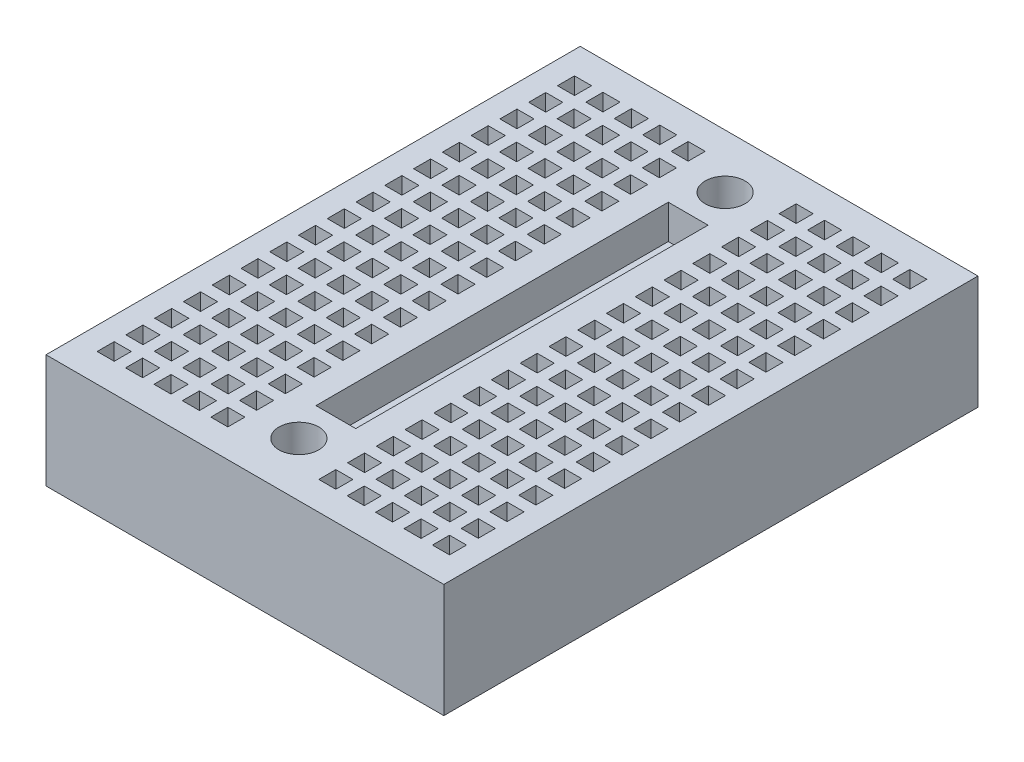
from build123d import *
from build123d.topology import SkipClean

# Parameters (mm, degrees)
SKETCH2_W           = 17.5
SKETCH2_H           = 47
BOSS_EXTRUDE1_DEPTH = 7
SKETCH3_W           = 1.5
SKETCH3_H           = 1.5
BOSS_EXTRUDE2_DEPTH = 3


with BuildPart() as part:
    # Sketch2 → Boss-Extrude1 (new body)
    with BuildSketch(Plane(origin=(0, 0, 0), x_dir=(1, 0, 0), z_dir=(0, 1, 0))):
        with Locations((-8.75, 0)):
            Rectangle(SKETCH2_W, SKETCH2_H)
    boss_extrude1 = extrude(amount=BOSS_EXTRUDE1_DEPTH)

    # Sketch3 → Boss-Extrude2 (add)
    with BuildSketch(Plane(origin=(0, 7, 0), x_dir=(1, 0, 0), z_dir=(0, 1, 0))):
        with BuildLine():
            Line((0, -17), (0, -15.5))
            Line((0, -15.5), (-1.75, -15.5))
            Line((-1.75, -15.5), (-1.75, 15.5))
            Line((-1.75, 15.5), (0, 15.5))
            Line((0, 15.5), (0, 17))
            ThreePointArc((0, 17), (-1.75, 18.75), (0, 20.5))
            Line((0, 20.5), (0, 23.5))
            Line((0, 23.5), (-17.5, 23.5))
            Line((-17.5, 23.5), (-17.5, -23.5))
            Line((-17.5, -23.5), (0, -23.5))
            Line((0, -23.5), (0, -20.5))
            ThreePointArc((0, -20.5), (-1.75, -18.75), (0, -17))
        make_face()
        with Locations((-14.75, -20.25)):
            Rectangle(SKETCH3_W, SKETCH3_H, mode=Mode.SUBTRACT)
        with Locations((-14.75, -17.71875)):
            Rectangle(SKETCH3_W, SKETCH3_H, mode=Mode.SUBTRACT)
        with Locations((-14.75, -15.1875)):
            Rectangle(SKETCH3_W, SKETCH3_H, mode=Mode.SUBTRACT)
        with Locations((-14.75, -12.65625)):
            Rectangle(SKETCH3_W, SKETCH3_H, mode=Mode.SUBTRACT)
        with Locations((-12.25, -20.25)):
            Rectangle(SKETCH3_W, SKETCH3_H, mode=Mode.SUBTRACT)
        with Locations((-12.25, -17.71875)):
            Rectangle(SKETCH3_W, SKETCH3_H, mode=Mode.SUBTRACT)
        with Locations((-9.75, -20.25)):
            Rectangle(SKETCH3_W, SKETCH3_H, mode=Mode.SUBTRACT)
        with Locations((-9.75, -17.71875)):
            Rectangle(SKETCH3_W, SKETCH3_H, mode=Mode.SUBTRACT)
        with Locations((-12.25, -15.1875)):
            Rectangle(SKETCH3_W, SKETCH3_H, mode=Mode.SUBTRACT)
        with Locations((-12.25, -12.65625)):
            Rectangle(SKETCH3_W, SKETCH3_H, mode=Mode.SUBTRACT)
        with Locations((-9.75, -15.1875)):
            Rectangle(SKETCH3_W, SKETCH3_H, mode=Mode.SUBTRACT)
        with Locations((-9.75, -12.65625)):
            Rectangle(SKETCH3_W, SKETCH3_H, mode=Mode.SUBTRACT)
        with Locations((-14.75, -10.125)):
            Rectangle(SKETCH3_W, SKETCH3_H, mode=Mode.SUBTRACT)
        with Locations((-14.75, -7.59375)):
            Rectangle(SKETCH3_W, SKETCH3_H, mode=Mode.SUBTRACT)
        with Locations((-14.75, -5.0625)):
            Rectangle(SKETCH3_W, SKETCH3_H, mode=Mode.SUBTRACT)
        with Locations((-14.75, -2.53125)):
            Rectangle(SKETCH3_W, SKETCH3_H, mode=Mode.SUBTRACT)
        with Locations((-12.25, -10.125)):
            Rectangle(SKETCH3_W, SKETCH3_H, mode=Mode.SUBTRACT)
        with Locations((-12.25, -7.59375)):
            Rectangle(SKETCH3_W, SKETCH3_H, mode=Mode.SUBTRACT)
        with Locations((-9.75, -10.125)):
            Rectangle(SKETCH3_W, SKETCH3_H, mode=Mode.SUBTRACT)
        with Locations((-9.75, -7.59375)):
            Rectangle(SKETCH3_W, SKETCH3_H, mode=Mode.SUBTRACT)
        with Locations((-12.25, -5.0625)):
            Rectangle(SKETCH3_W, SKETCH3_H, mode=Mode.SUBTRACT)
        with Locations((-12.25, -2.53125)):
            Rectangle(SKETCH3_W, SKETCH3_H, mode=Mode.SUBTRACT)
        with Locations((-9.75, -5.0625)):
            Rectangle(SKETCH3_W, SKETCH3_H, mode=Mode.SUBTRACT)
        with Locations((-9.75, -2.53125)):
            Rectangle(SKETCH3_W, SKETCH3_H, mode=Mode.SUBTRACT)
        with Locations((-7.25, -20.25)):
            Rectangle(SKETCH3_W, SKETCH3_H, mode=Mode.SUBTRACT)
        with Locations((-7.25, -17.71875)):
            Rectangle(SKETCH3_W, SKETCH3_H, mode=Mode.SUBTRACT)
        with Locations((-4.75, -20.25)):
            Rectangle(SKETCH3_W, SKETCH3_H, mode=Mode.SUBTRACT)
        with Locations((-4.75, -17.71875)):
            Rectangle(SKETCH3_W, SKETCH3_H, mode=Mode.SUBTRACT)
        with Locations((-7.25, -15.1875)):
            Rectangle(SKETCH3_W, SKETCH3_H, mode=Mode.SUBTRACT)
        with Locations((-7.25, -12.65625)):
            Rectangle(SKETCH3_W, SKETCH3_H, mode=Mode.SUBTRACT)
        with Locations((-4.75, -15.1875)):
            Rectangle(SKETCH3_W, SKETCH3_H, mode=Mode.SUBTRACT)
        with Locations((-4.75, -12.65625)):
            Rectangle(SKETCH3_W, SKETCH3_H, mode=Mode.SUBTRACT)
        with Locations((-7.25, -10.125)):
            Rectangle(SKETCH3_W, SKETCH3_H, mode=Mode.SUBTRACT)
        with Locations((-7.25, -7.59375)):
            Rectangle(SKETCH3_W, SKETCH3_H, mode=Mode.SUBTRACT)
        with Locations((-4.75, -10.125)):
            Rectangle(SKETCH3_W, SKETCH3_H, mode=Mode.SUBTRACT)
        with Locations((-4.75, -7.59375)):
            Rectangle(SKETCH3_W, SKETCH3_H, mode=Mode.SUBTRACT)
        with Locations((-7.25, -5.0625)):
            Rectangle(SKETCH3_W, SKETCH3_H, mode=Mode.SUBTRACT)
        with Locations((-7.25, -2.53125)):
            Rectangle(SKETCH3_W, SKETCH3_H, mode=Mode.SUBTRACT)
        with Locations((-4.75, -5.0625)):
            Rectangle(SKETCH3_W, SKETCH3_H, mode=Mode.SUBTRACT)
        with Locations((-4.75, -2.53125)):
            Rectangle(SKETCH3_W, SKETCH3_H, mode=Mode.SUBTRACT)
        with Locations((-14.75, 0)):
            Rectangle(SKETCH3_W, SKETCH3_H, mode=Mode.SUBTRACT)
        with Locations((-14.75, 2.53125)):
            Rectangle(SKETCH3_W, SKETCH3_H, mode=Mode.SUBTRACT)
        with Locations((-14.75, 5.0625)):
            Rectangle(SKETCH3_W, SKETCH3_H, mode=Mode.SUBTRACT)
        with Locations((-14.75, 7.59375)):
            Rectangle(SKETCH3_W, SKETCH3_H, mode=Mode.SUBTRACT)
        with Locations((-14.75, 10.125)):
            Rectangle(SKETCH3_W, SKETCH3_H, mode=Mode.SUBTRACT)
        with Locations((-12.25, 0)):
            Rectangle(SKETCH3_W, SKETCH3_H, mode=Mode.SUBTRACT)
        with Locations((-12.25, 2.53125)):
            Rectangle(SKETCH3_W, SKETCH3_H, mode=Mode.SUBTRACT)
        with Locations((-12.25, 5.0625)):
            Rectangle(SKETCH3_W, SKETCH3_H, mode=Mode.SUBTRACT)
        with Locations((-9.75, 0)):
            Rectangle(SKETCH3_W, SKETCH3_H, mode=Mode.SUBTRACT)
        with Locations((-9.75, 2.53125)):
            Rectangle(SKETCH3_W, SKETCH3_H, mode=Mode.SUBTRACT)
        with Locations((-9.75, 5.0625)):
            Rectangle(SKETCH3_W, SKETCH3_H, mode=Mode.SUBTRACT)
        with Locations((-12.25, 7.59375)):
            Rectangle(SKETCH3_W, SKETCH3_H, mode=Mode.SUBTRACT)
        with Locations((-12.25, 10.125)):
            Rectangle(SKETCH3_W, SKETCH3_H, mode=Mode.SUBTRACT)
        with Locations((-9.75, 7.59375)):
            Rectangle(SKETCH3_W, SKETCH3_H, mode=Mode.SUBTRACT)
        with Locations((-9.75, 10.125)):
            Rectangle(SKETCH3_W, SKETCH3_H, mode=Mode.SUBTRACT)
        with Locations((-14.75, 12.65625)):
            Rectangle(SKETCH3_W, SKETCH3_H, mode=Mode.SUBTRACT)
        with Locations((-14.75, 15.1875)):
            Rectangle(SKETCH3_W, SKETCH3_H, mode=Mode.SUBTRACT)
        with Locations((-14.75, 17.71875)):
            Rectangle(SKETCH3_W, SKETCH3_H, mode=Mode.SUBTRACT)
        with Locations((-14.75, 20.25)):
            Rectangle(SKETCH3_W, SKETCH3_H, mode=Mode.SUBTRACT)
        with Locations((-12.25, 12.65625)):
            Rectangle(SKETCH3_W, SKETCH3_H, mode=Mode.SUBTRACT)
        with Locations((-12.25, 15.1875)):
            Rectangle(SKETCH3_W, SKETCH3_H, mode=Mode.SUBTRACT)
        with Locations((-9.75, 12.65625)):
            Rectangle(SKETCH3_W, SKETCH3_H, mode=Mode.SUBTRACT)
        with Locations((-9.75, 15.1875)):
            Rectangle(SKETCH3_W, SKETCH3_H, mode=Mode.SUBTRACT)
        with Locations((-12.25, 17.71875)):
            Rectangle(SKETCH3_W, SKETCH3_H, mode=Mode.SUBTRACT)
        with Locations((-12.25, 20.25)):
            Rectangle(SKETCH3_W, SKETCH3_H, mode=Mode.SUBTRACT)
        with Locations((-9.75, 17.71875)):
            Rectangle(SKETCH3_W, SKETCH3_H, mode=Mode.SUBTRACT)
        with Locations((-9.75, 20.25)):
            Rectangle(SKETCH3_W, SKETCH3_H, mode=Mode.SUBTRACT)
        with Locations((-7.25, 0)):
            Rectangle(SKETCH3_W, SKETCH3_H, mode=Mode.SUBTRACT)
        with Locations((-7.25, 2.53125)):
            Rectangle(SKETCH3_W, SKETCH3_H, mode=Mode.SUBTRACT)
        with Locations((-7.25, 5.0625)):
            Rectangle(SKETCH3_W, SKETCH3_H, mode=Mode.SUBTRACT)
        with Locations((-4.75, 0)):
            Rectangle(SKETCH3_W, SKETCH3_H, mode=Mode.SUBTRACT)
        with Locations((-4.75, 2.53125)):
            Rectangle(SKETCH3_W, SKETCH3_H, mode=Mode.SUBTRACT)
        with Locations((-4.75, 5.0625)):
            Rectangle(SKETCH3_W, SKETCH3_H, mode=Mode.SUBTRACT)
        with Locations((-7.25, 7.59375)):
            Rectangle(SKETCH3_W, SKETCH3_H, mode=Mode.SUBTRACT)
        with Locations((-7.25, 10.125)):
            Rectangle(SKETCH3_W, SKETCH3_H, mode=Mode.SUBTRACT)
        with Locations((-4.75, 7.59375)):
            Rectangle(SKETCH3_W, SKETCH3_H, mode=Mode.SUBTRACT)
        with Locations((-4.75, 10.125)):
            Rectangle(SKETCH3_W, SKETCH3_H, mode=Mode.SUBTRACT)
        with Locations((-7.25, 12.65625)):
            Rectangle(SKETCH3_W, SKETCH3_H, mode=Mode.SUBTRACT)
        with Locations((-7.25, 15.1875)):
            Rectangle(SKETCH3_W, SKETCH3_H, mode=Mode.SUBTRACT)
        with Locations((-4.75, 12.65625)):
            Rectangle(SKETCH3_W, SKETCH3_H, mode=Mode.SUBTRACT)
        with Locations((-4.75, 15.1875)):
            Rectangle(SKETCH3_W, SKETCH3_H, mode=Mode.SUBTRACT)
        with Locations((-7.25, 17.71875)):
            Rectangle(SKETCH3_W, SKETCH3_H, mode=Mode.SUBTRACT)
        with Locations((-7.25, 20.25)):
            Rectangle(SKETCH3_W, SKETCH3_H, mode=Mode.SUBTRACT)
        with Locations((-4.75, 17.71875)):
            Rectangle(SKETCH3_W, SKETCH3_H, mode=Mode.SUBTRACT)
        with Locations((-4.75, 20.25)):
            Rectangle(SKETCH3_W, SKETCH3_H, mode=Mode.SUBTRACT)
    boss_extrude2 = extrude(amount=BOSS_EXTRUDE2_DEPTH)

    # Mirror1: Boss-Extrude1, Boss-Extrude2 across plane
    with SkipClean():  # the faces are left unmerged after this step: merging them gives an invalid solid
        add(boss_extrude1.mirror(Plane(origin=(0, 7, -23.5), x_dir=(0, 0, 1), z_dir=(-1, 0, 0))))
        add(boss_extrude2.mirror(Plane(origin=(0, 7, -23.5), x_dir=(0, 0, 1), z_dir=(-1, 0, 0))))


solid = part.part
